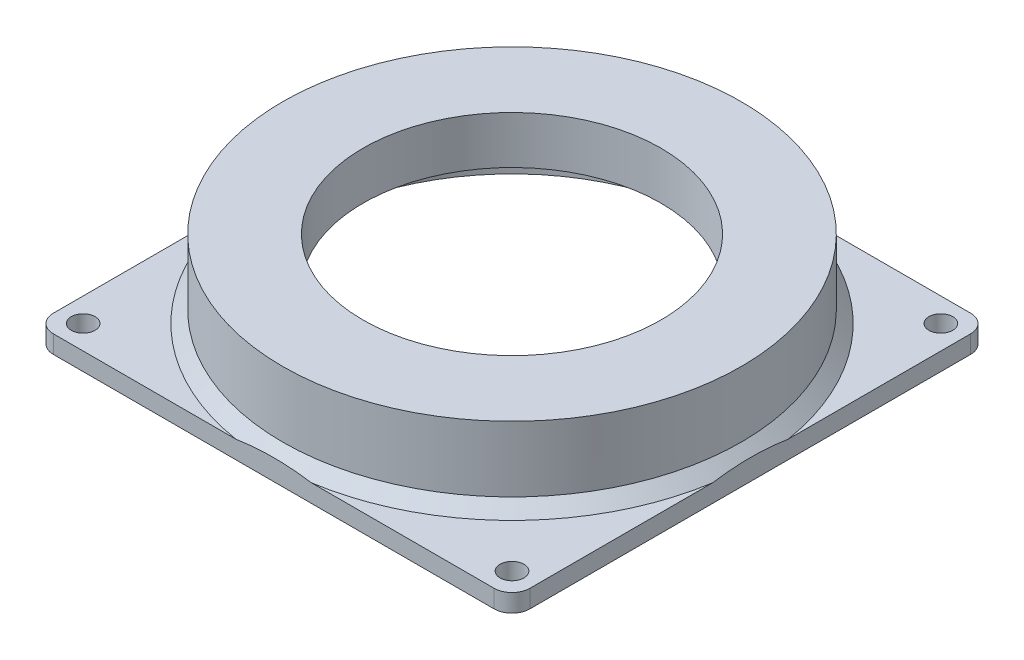
from build123d import *

# Parameters (mm, degrees)
SKETCH1_W           = 80
SKETCH1_H           = 80
BOSS_EXTRUDE1_DEPTH = 3
FILLET1_R           = 3
SKETCH2_R           = 2
CUT_EXTRUDE1_DEPTH  = 3
SKETCH3_R           = 35
CUT_EXTRUDE2_DEPTH  = 3
BOSS_EXTRUDE2_START = 10
SKETCH4_R           = 38.5
SKETCH4_R_2         = 35
BOSS_EXTRUDE2_DEPTH = 10
BOSS_EXTRUDE3_START = 3
SKETCH5_R           = 38.5
BOSS_EXTRUDE3_DEPTH = 3
SKETCH6_R           = 25
CUT_EXTRUDE3_DEPTH  = 3
SKETCH7_R           = 28.5
SKETCH7_R_2         = 25
BOSS_EXTRUDE4_DEPTH = 5
CHAMFER1_SIZE       = 2
CHAMFER2_SIZE       = 2


with BuildPart() as part:
    # Sketch1 → Boss-Extrude1 (new body)
    with BuildSketch(Plane(origin=(0, 0, 0), x_dir=(1, 0, 0), z_dir=(0, 1, 0))):
        Rectangle(SKETCH1_W, SKETCH1_H)
    extrude(amount=BOSS_EXTRUDE1_DEPTH)

    # Fillet1
    fillet1_edges = [part.edges().sort_by_distance(p)[0] for p in [
        (40, 1.5, 40),
        (-40, 1.5, 40),
        (-40, 1.5, -40),
        (40, 1.5, -40),
    ]]
    fillet(fillet1_edges, radius=FILLET1_R)

    # Sketch2 → Cut-Extrude1 (cut)
    with BuildSketch(Plane(origin=(0, 3, 0), x_dir=(1, 0, 0), z_dir=(0, 1, 0))):
        with Locations(Location((-36, 36, 0), (0, 0, 270))):
            Circle(SKETCH2_R)
        with Locations(Location((36, 36, 0), (0, 0, 270))):
            Circle(SKETCH2_R)
        with Locations(Location((-36, -36, 0), (0, 0, 270))):
            Circle(SKETCH2_R)
        with Locations(Location((36, -36, 0), (0, 0, 270))):
            Circle(SKETCH2_R)
    extrude(amount=-CUT_EXTRUDE1_DEPTH, mode=Mode.SUBTRACT)

    # Sketch3 → Cut-Extrude2 (cut)
    with BuildSketch(Plane(origin=(0, 3, 0), x_dir=(1, 0, 0), z_dir=(0, 1, 0))):
        with Locations(Location((0, 0, 0), (0, 0, 270))):
            Circle(SKETCH3_R)
    extrude(amount=-CUT_EXTRUDE2_DEPTH, mode=Mode.SUBTRACT)

    # Sketch4 → Boss-Extrude2 (add)
    with BuildSketch(Plane(origin=(0, 3, 0), x_dir=(1, 0, 0), z_dir=(0, 1, 0)).offset(BOSS_EXTRUDE2_START)):
        with Locations(Location((0, 0, 0), (0, 0, 270))):
            Circle(SKETCH4_R)
        with Locations(Location((0, 0, 0), (0, 0, 270))):
            Circle(SKETCH4_R_2, mode=Mode.SUBTRACT)
    extrude(amount=-BOSS_EXTRUDE2_DEPTH)

    # Sketch5 → Boss-Extrude3 (add)
    with BuildSketch(Plane(origin=(0, 13, 0), x_dir=(1, 0, 0), z_dir=(0, 1, 0)).offset(BOSS_EXTRUDE3_START)):
        with Locations(Location((0, 0, 0), (0, 0, 270))):
            Circle(SKETCH5_R)
    extrude(amount=-BOSS_EXTRUDE3_DEPTH)

    # Sketch6 → Cut-Extrude3 (cut)
    with BuildSketch(Plane(origin=(0, 16, 0), x_dir=(1, 0, 0), z_dir=(0, 1, 0))):
        with Locations(Location((0, 0, 0), (0, 0, 270))):
            Circle(SKETCH6_R)
    extrude(amount=-CUT_EXTRUDE3_DEPTH, mode=Mode.SUBTRACT)

    # Sketch7 → Boss-Extrude4 (add)
    with BuildSketch(Plane.XZ.offset(-13)):
        with Locations(Location((0, 0, 0), (0, 0, 90))):
            Circle(SKETCH7_R)
        with Locations(Location((0, 0, 0), (0, 0, 90))):
            Circle(SKETCH7_R_2, mode=Mode.SUBTRACT)
    extrude(amount=BOSS_EXTRUDE4_DEPTH)

    # Chamfer1
    chamfer1_edges = [part.edges().sort_by_distance(p)[0] for p in [
        (0, 13, -28.5),
    ]]
    chamfer(chamfer1_edges, length=CHAMFER1_SIZE)

    # Chamfer2
    # the kernel refuses this chamfer: 2 mm, written as the material it adds along each edge
    with BuildSketch(Plane(origin=(0, 3, 0), x_dir=(0, 0, 1), z_dir=(-1, 0, 0))) as chamfer2_piece_1_section:
        Polygon((38.5 + CHAMFER2_SIZE, 0), (38.5, CHAMFER2_SIZE), (38.5, 0), align=None)
    chamfer2_piece_1 = revolve(axis=Axis((0, 3, 0), (0, 1, 0)), mode=Mode.PRIVATE)
    chamfer2_piece_1 = split(chamfer2_piece_1, bisect_by=Plane(origin=(0, 3.942538478, -40), z_dir=(0, 0, 1)), keep=Keep.TOP, mode=Mode.PRIVATE)
    chamfer2_piece_1 = split(chamfer2_piece_1, bisect_by=Plane(origin=(-40, 3.942538478, -39.442538478), z_dir=(1, 0, 0)), keep=Keep.TOP, mode=Mode.PRIVATE)
    chamfer2_piece_1 = split(chamfer2_piece_1, bisect_by=Plane(origin=(40, 3.942538478, -39.442538478), z_dir=(-1, 0, 0)), keep=Keep.TOP, mode=Mode.PRIVATE)
    chamfer2_piece_1 = split(chamfer2_piece_1, bisect_by=Plane(origin=(0, 3.942538478, 40), z_dir=(0, 0, -1)), keep=Keep.TOP, mode=Mode.PRIVATE)
    add(chamfer2_piece_1)


solid = part.part
